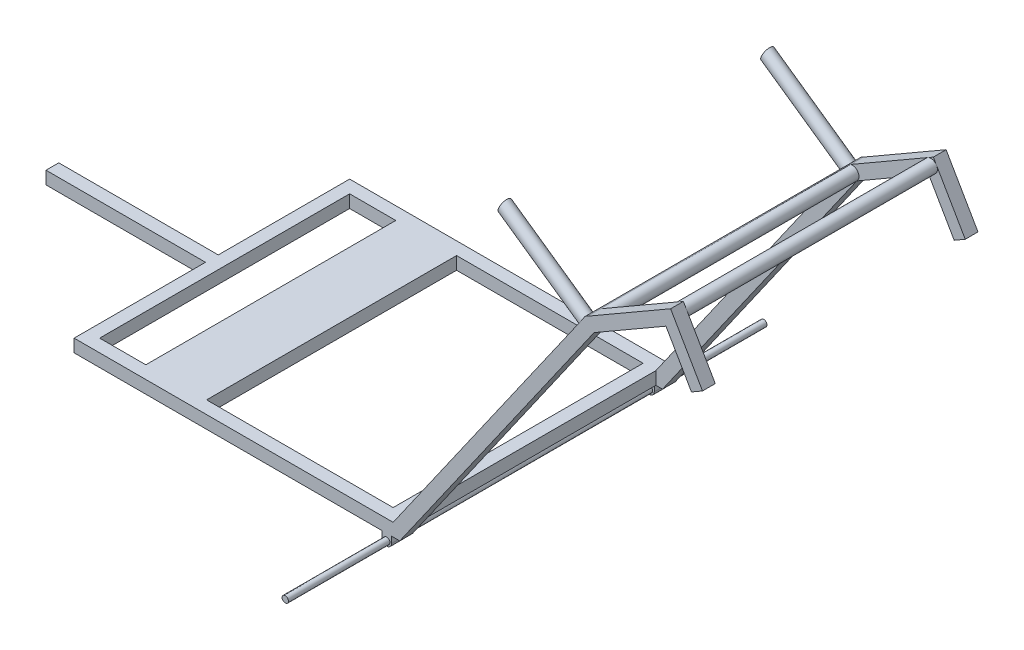
from build123d import *

# Parameters (mm, degrees)
SKETCH6_W                       = 500
SKETCH6_H                       = 431.8
SKETCH6_W_2                     = 460
SKETCH6_H_2                     = 391.8
SKETCH6_W_3                     = 95.25
SKETCH6_W_4                     = 250
SKETCH6_H_3                     = 20
BOSS_EXTRUDE2_DEPTH             = 20
BOSS_EXTRUDE6_START             = -195.9
SKETCH8_R                       = 5
BOSS_EXTRUDE6_DEPTH             = 20
BOSS_EXTRUDE7_START             = 215.9
SKETCH8_6_R                     = 5
BOSS_EXTRUDE7_DEPTH             = 20
BOSS_EXTRUDE8_REACH             = 783.357
SKETCH8_7_R                     = 5
BOSS_EXTRUDE8_DIRECTION_2_REACH = 783.357
BOSS_EXTRUDE9_START             = -195.9
BOSS_EXTRUDE9_DEPTH             = 20
BOSS_EXTRUDE10_START            = 195.9
BOSS_EXTRUDE10_DEPTH            = 20
BOSS_EXTRUDE11_START            = 179.1
SKETCH8_8_R                     = 5
BOSS_EXTRUDE11_DEPTH            = 195.9
BOSS_EXTRUDE12_START            = -375
SKETCH8_9_R                     = 5
BOSS_EXTRUDE12_DEPTH            = 195.9
BOSS_EXTRUDE13_START            = -195.9
BOSS_EXTRUDE13_DEPTH            = 391.8
BOSS_EXTRUDE14_START            = -195.9
BOSS_EXTRUDE14_DEPTH            = 391.8
BOSS_EXTRUDE15_START            = -195.9
SKETCH9_6_R                     = 10
BOSS_EXTRUDE15_DEPTH            = 391.8
BOSS_EXTRUDE16_REACH            = 982.051
SKETCH10_R                      = 10


# Read off the part's stored shape, not the designer's step: Boss-Extrude10, Boss-Extrude14
with BuildPart() as part:
    # Sketch6 → Boss-Extrude2 (new body)
    # profile 1 of 3: a face of its own
    with BuildSketch(Plane(origin=(0, 0, 0), x_dir=(1, 0, 0), z_dir=(0, 1, 0))):
        with Locations((-250, 0)):
            Rectangle(SKETCH6_W, SKETCH6_H)
        with Locations((-250, 0)):
            Rectangle(SKETCH6_W_2, SKETCH6_H_2, mode=Mode.SUBTRACT)
    # profile 2 of 3: a face of its own
    with BuildSketch(Plane(origin=(0, 0, 0), x_dir=(1, 0, 0), z_dir=(0, 1, 0))):
        with Locations((-360, 0)):
            Rectangle(SKETCH6_W_3, SKETCH6_H_2)
    # profile 3 of 3: a face of its own
    with BuildSketch(Plane(origin=(0, 0, 0), x_dir=(1, 0, 0), z_dir=(0, 1, 0))):
        with Locations((-625, 0)):
            Rectangle(SKETCH6_W_4, SKETCH6_H_3)
    extrude(amount=-BOSS_EXTRUDE2_DEPTH)

    # Sketch8 → Boss-Extrude6 (add)
    # profile 1 of 2: a face of its own
    with BuildSketch(Plane.XY.offset(BOSS_EXTRUDE6_START)):
        with BuildLine():
            Line((-2.5, -30), (-2.5, -20))
            Line((-2.5, -20), (-17.5, -20))
            Line((-17.5, -20), (-17.5, -30))
            ThreePointArc((-17.5, -30), (-10, -37.5), (-2.5, -30))
        make_face()
        with Locations((-10, -30)):
            Circle(SKETCH8_R, mode=Mode.SUBTRACT)
    # profile 2 of 2: a face of its own
    with BuildSketch(Plane.XY.offset(BOSS_EXTRUDE6_START)):
        with Locations((-10, -30)):
            Circle(SKETCH8_R)
    extrude(amount=-BOSS_EXTRUDE6_DEPTH)

    # Sketch8<6> → Boss-Extrude7 (add)
    # profile 1 of 2: a face of its own
    with BuildSketch(Plane.XY.offset(BOSS_EXTRUDE7_START)):
        with BuildLine():
            Line((-2.5, -30), (-2.5, -20))
            Line((-2.5, -20), (-17.5, -20))
            Line((-17.5, -20), (-17.5, -30))
            ThreePointArc((-17.5, -30), (-10, -37.5), (-2.5, -30))
        make_face()
        with Locations((-10, -30)):
            Circle(SKETCH8_6_R, mode=Mode.SUBTRACT)
    # profile 2 of 2: a face of its own
    with BuildSketch(Plane.XY.offset(BOSS_EXTRUDE7_START)):
        with Locations((-10, -30)):
            Circle(SKETCH8_6_R)
    extrude(amount=-BOSS_EXTRUDE7_DEPTH)

    # Boss-Extrude8: up to this face of the body (flat: up to its plane)
    boss_extrude8_end = Plane(part.part.faces().sort_by_distance((-166.1875, -10, 195.9))[0])
    # Sketch8<7> → Boss-Extrude8 (add, up to the picked face)
    with BuildSketch(Plane.XY, mode=Mode.PRIVATE) as boss_extrude8_sk1:
        with Locations((-10, -30)):
            Circle(SKETCH8_7_R)
    boss_extrude8_tool1 = split(extrude(boss_extrude8_sk1.sketch, amount=BOSS_EXTRUDE8_REACH, mode=Mode.PRIVATE), bisect_by=boss_extrude8_end, keep=Keep.BOTH, mode=Mode.PRIVATE)
    add(boss_extrude8_tool1.solids().sort_by(Axis((-10, -30, 0), (0, 0, 1)))[0])

    # Boss-Extrude8 direction 2: up to this face of the body (flat: up to its plane)
    boss_extrude8_direction_2_end = Plane(part.part.faces().sort_by_distance((-443.8125, -10, -195.9))[0])
    # Sketch8<7> → Boss-Extrude8 direction 2 (add, up to the picked face)
    with BuildSketch(Plane.XY, mode=Mode.PRIVATE) as boss_extrude8_direction_2_sk1:
        with Locations((-10, -30)):
            Circle(SKETCH8_7_R)
    boss_extrude8_direction_2_tool1 = split(extrude(boss_extrude8_direction_2_sk1.sketch, amount=-BOSS_EXTRUDE8_DIRECTION_2_REACH, mode=Mode.PRIVATE), bisect_by=boss_extrude8_direction_2_end, keep=Keep.BOTH, mode=Mode.PRIVATE)
    add(boss_extrude8_direction_2_tool1.solids().sort_by(Axis((-10, -30, 0), (0, 0, -1)))[0])

    # Sketch9 → Boss-Extrude9 (add)
    with BuildSketch(Plane.XY.offset(BOSS_EXTRUDE9_START)):
        with BuildLine():
            Line((298.618579246, 426.471528727), (0, 0))
            Line((0, 0), (0, -20))
            Line((0, -20), (10.411341011, -20))
            Line((10.411341011, -20), (315.001620132, 415))
            Line((315.001620132, 415), (427.584922624, 480))
            Line((427.584922624, 480), (467.584922624, 410.717967697))
            Line((467.584922624, 410.717967697), (484.9054307, 420.717967697))
            Line((484.9054307, 420.717967697), (434.9054307, 507.320508076))
            Line((434.9054307, 507.320508076), (305.001620132, 432.320508076))
            ThreePointArc((305.001620132, 432.320508076), (301.161755938, 430.103561449), (298.618579246, 426.471528727))
        make_face()
    extrude(amount=-BOSS_EXTRUDE9_DEPTH)

    # Boss-Extrude10 outline → Boss-Extrude10 (add)
    with BuildSketch(Plane.XY.offset(BOSS_EXTRUDE10_START)):
        with BuildLine():
            Line((434.9054307, 507.320508076), (305.001620132, 432.320508076))
            ThreePointArc((305.001620132, 432.320508076), (301.161755938, 430.103561449), (298.618579246, 426.471528727))
            Line((298.618579246, 426.471528727), (0, 0))
            Line((0, 0), (0, -20))
            Line((0, -20), (10.411341011, -20))
            Line((10.411341011, -20), (315.001620132, 415))
            Line((315.001620132, 415), (427.584922624, 480))
            Line((427.584922624, 480), (467.584922624, 410.717967697))
            Line((467.584922624, 410.717967697), (484.9054307, 420.717967697))
            Line((484.9054307, 420.717967697), (434.9054307, 507.320508076))
        make_face()
    extrude(amount=BOSS_EXTRUDE10_DEPTH)

    # Sketch8<8> → Boss-Extrude11 (add)
    with BuildSketch(Plane.XY.offset(BOSS_EXTRUDE11_START)):
        with Locations((-10, -30)):
            Circle(SKETCH8_8_R)
    extrude(amount=BOSS_EXTRUDE11_DEPTH)

    # Sketch8<9> → Boss-Extrude12 (add)
    with BuildSketch(Plane.XY.offset(BOSS_EXTRUDE12_START)):
        with Locations((-10, -30)):
            Circle(SKETCH8_9_R)
    extrude(amount=BOSS_EXTRUDE12_DEPTH)

    # Boss-Extrude14 outline → Boss-Extrude14 (add)
    with BuildSketch(Plane.XY.offset(BOSS_EXTRUDE14_START)):
        with BuildLine():
            ThreePointArc((301.161755938, 430.103561449), (313.203085607, 413.681259926), (305.001620132, 432.320508076))
            Line((305.001620132, 432.320508076), (301.161755938, 430.103561449))
        make_face()
    extrude(amount=BOSS_EXTRUDE14_DEPTH)

    # Sketch9<6> → Boss-Extrude15 (add)
    with BuildSketch(Plane.XY.offset(BOSS_EXTRUDE15_START)):
        with Locations(Location((431.245176662, 493.660254038, 0), (0, 0, 120))):
            Circle(SKETCH9_6_R)
    extrude(amount=BOSS_EXTRUDE15_DEPTH)


with BuildPart() as body_2:
    # Sketch9<4> → Boss-Extrude13 (new body)
    with BuildSketch(Plane.XY.offset(BOSS_EXTRUDE13_START)):
        with BuildLine():
            Line((301.161755938, 430.103561449), (298.618579246, 426.471528727))
            ThreePointArc((298.618579246, 426.471528727), (302.206662098, 414.161374144), (315.001620132, 415))
            ThreePointArc((315.001620132, 415), (317.457036008, 418.426528886), (318.324483178, 422.551780725))
            ThreePointArc((318.324483178, 422.551780725), (314.138351629, 430.8120276), (305.001620132, 432.320508076))
            Line((305.001620132, 432.320508076), (301.161755938, 430.103561449))
        make_face()
    extrude(amount=BOSS_EXTRUDE13_DEPTH)


    add(part.part)  # Boss-Extrude16 merges part
    # Boss-Extrude16: up to this plane
    boss_extrude16_end = Plane(origin=(-17.660444431, 6.427876097, 0), z_dir=(0.939692620785907, -0.3420201433256725, 0))
    # Sketch10 → Boss-Extrude16 (add, up to the surface)
    with BuildSketch(Plane(origin=(0, 0, 0), x_dir=(0, 0, 1), z_dir=(-0.8191520442889914, 0.5735764363510468, 0)), mode=Mode.PRIVATE) as boss_extrude16_sk1:
        with Locations(Location((-205.9, 510.6256051, 0), (0, 0, 90))):
            Circle(SKETCH10_R)
    boss_extrude16_tool1 = split(extrude(boss_extrude16_sk1.sketch, amount=BOSS_EXTRUDE16_REACH, mode=Mode.PRIVATE), bisect_by=boss_extrude16_end, keep=Keep.BOTH, mode=Mode.PRIVATE)
    boss_extrude16 = boss_extrude16_tool1.solids().sort_by_distance((292.882815, 418.280008, -205.9))[0]
    add(boss_extrude16)

    # Mirror1: Boss-Extrude16 across plane
    add(boss_extrude16.mirror(Plane.XY))


solid = body_2.part
